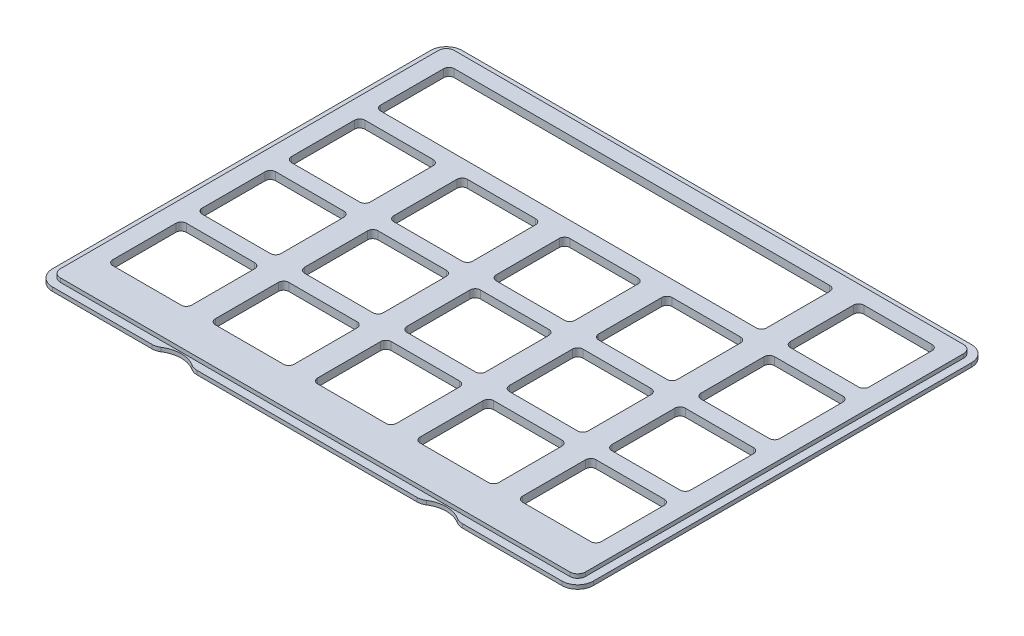
from build123d import *

# Parameters (mm, degrees)
SKETCH1_W                 = 206
SKETCH1_H                 = 156
OUTER_PROFILE_DEPTH       = 1.5
SKETCH2_W                 = 200
SKETCH2_H                 = 150
INNER_PROFILE_DEPTH       = 1.5
FILLET1_R                 = 3
FILLET2_R                 = 6
SKETCH5_W                 = 30
SKETCH5_H                 = 28
CUTOUT_DEPTH              = 130.236217834
CORNER_RAD_R              = 2
LPATTERN1_COUNT           = 5
LPATTERN1_PITCH           = 39
LPATTERN1_COUNT_DIR2      = 4
LPATTERN1_PITCH_DIR2      = 34
CORNER_RAD_OF_LPATTERN1_R = 2
SKETCH6_W                 = 91
SKETCH6_H                 = 28
CUT_EXTRUDE1_DEPTH        = 130.236217834
CUT_EXTRUDE2_DEPTH        = 130.236217834
FILLET3_R                 = 5
FILLET3_OF_MIRROR1_R      = 5


with BuildPart() as part:
    # Sketch1 → Outer Profile (new body)
    with BuildSketch(Plane(origin=(0, 0, 0), x_dir=(1, 0, 0), z_dir=(0, 1, 0))):
        Rectangle(SKETCH1_W, SKETCH1_H)
    extrude(amount=OUTER_PROFILE_DEPTH)

    # Sketch2 → Inner Profile (add)
    with BuildSketch(Plane(origin=(0, 1.5, 0), x_dir=(1, 0, 0), z_dir=(0, 1, 0))):
        Rectangle(SKETCH2_W, SKETCH2_H)
    extrude(amount=INNER_PROFILE_DEPTH)

    # Fillet1
    fillet1_edges = [part.edges().sort_by_distance(p)[0] for p in [
        (100, 2.25, 75),
        (100, 2.25, -75),
        (-100, 2.25, -75),
        (-100, 2.25, 75),
    ]]
    fillet(fillet1_edges, radius=FILLET1_R)

    # Fillet2
    fillet2_edges = [part.edges().sort_by_distance(p)[0] for p in [
        (-103, 0.75, -78),
        (103, 0.75, -78),
        (103, 0.75, 78),
        (-103, 0.75, 78),
    ]]
    fillet(fillet2_edges, radius=FILLET2_R)

    # Sketch5 → Cutout (cut, through all)
    with BuildSketch(Plane(origin=(0, 3, 0), x_dir=(1, 0, 0), z_dir=(0, 1, 0))):
        with Locations((-78, -47)):
            Rectangle(SKETCH5_W, SKETCH5_H)
    cutout = extrude(amount=-CUTOUT_DEPTH, mode=Mode.SUBTRACT)

    # Corner Rad
    corner_rad_edges = [part.edges().sort_by_distance(p)[0] for p in [
        (-63, 1.5, 61),
        (-63, 1.5, 33),
        (-93, 1.5, 33),
        (-93, 1.5, 61),
    ]]
    fillet(corner_rad_edges, radius=CORNER_RAD_R)

    # LPattern1: Cutout 5 × 4
    with Locations(*[(i * LPATTERN1_PITCH, 0, -j * LPATTERN1_PITCH_DIR2) for i in range(LPATTERN1_COUNT) for j in range(LPATTERN1_COUNT_DIR2) if (i, j) != (0, 0)]):
        add(cutout, mode=Mode.SUBTRACT)

    # Corner Rad of LPattern1
    corner_rad_of_lpattern1_edges = [part.edges().sort_by_distance(p)[0] for p in [
        (-63, 1.5, 27),
        (-63, 1.5, -1),
        (-93, 1.5, -1),
        (-93, 1.5, 27),
        (-63, 1.5, -7),
        (-63, 1.5, -35),
        (-93, 1.5, -35),
        (-93, 1.5, -7),
        (-63, 1.5, -41),
        (-63, 1.5, -69),
        (-93, 1.5, -69),
        (-93, 1.5, -41),
        (-24, 1.5, 61),
        (-24, 1.5, 33),
        (-54, 1.5, 33),
        (-54, 1.5, 61),
        (-24, 1.5, 27),
        (-24, 1.5, -1),
        (-54, 1.5, -1),
        (-54, 1.5, 27),
        (-24, 1.5, -7),
        (-24, 1.5, -35),
        (-54, 1.5, -35),
        (-54, 1.5, -7),
        (-24, 1.5, -41),
        (-24, 1.5, -69),
        (-54, 1.5, -69),
        (-54, 1.5, -41),
        (15, 1.5, 61),
        (15, 1.5, 33),
        (-15, 1.5, 33),
        (-15, 1.5, 61),
        (15, 1.5, 27),
        (15, 1.5, -1),
        (-15, 1.5, -1),
        (-15, 1.5, 27),
        (15, 1.5, -7),
        (15, 1.5, -35),
        (-15, 1.5, -35),
        (-15, 1.5, -7),
        (15, 1.5, -41),
        (15, 1.5, -69),
        (-15, 1.5, -69),
        (-15, 1.5, -41),
        (54, 1.5, 61),
        (54, 1.5, 33),
        (24, 1.5, 33),
        (24, 1.5, 61),
        (54, 1.5, 27),
        (54, 1.5, -1),
        (24, 1.5, -1),
        (24, 1.5, 27),
        (54, 1.5, -7),
        (54, 1.5, -35),
        (24, 1.5, -35),
        (24, 1.5, -7),
        (54, 1.5, -41),
        (54, 1.5, -69),
        (24, 1.5, -69),
        (24, 1.5, -41),
        (93, 1.5, 61),
        (93, 1.5, 33),
        (63, 1.5, 33),
        (63, 1.5, 61),
        (93, 1.5, 27),
        (93, 1.5, -1),
        (63, 1.5, -1),
        (63, 1.5, 27),
        (93, 1.5, -7),
        (93, 1.5, -35),
        (63, 1.5, -35),
        (63, 1.5, -7),
        (93, 1.5, -41),
        (93, 1.5, -69),
        (63, 1.5, -69),
        (63, 1.5, -41),
    ]]
    fillet(corner_rad_of_lpattern1_edges, radius=CORNER_RAD_OF_LPATTERN1_R)

    # Sketch6 → Cut-Extrude1 (cut, through all)
    with BuildSketch(Plane(origin=(0, 3, 0), x_dir=(1, 0, 0), z_dir=(0, 1, 0))):
        with Locations((-19.5, 55)):
            Rectangle(SKETCH6_W, SKETCH6_H)
    extrude(amount=-CUT_EXTRUDE1_DEPTH, mode=Mode.SUBTRACT)

    # Sketch7 → Cut-Extrude2 (cut, through all)
    with BuildSketch(Plane(origin=(0, 3, 0), x_dir=(1, 0, 0), z_dir=(0, 1, 0))):
        with BuildLine():
            Line((-57.5, -78), (-43.5, -78))
            ThreePointArc((-43.5, -78), (-50.5, -75.5), (-57.5, -78))
        make_face()
    cut_extrude2 = extrude(amount=-CUT_EXTRUDE2_DEPTH, mode=Mode.SUBTRACT)

    # Fillet3
    fillet3_edges = [part.edges().sort_by_distance(p)[0] for p in [
        (-57.5, 0.75, 78),
        (-43.5, 0.75, 78),
    ]]
    fillet(fillet3_edges, radius=FILLET3_R)

    # Mirror1: Cut-Extrude2 across plane
    add(cut_extrude2.mirror(Plane(origin=(0, 0, 0), x_dir=(0, 0, 1), z_dir=(1, 0, 0))), mode=Mode.SUBTRACT)

    # Fillet3 of Mirror1
    fillet3_of_mirror1_edges = [part.edges().sort_by_distance(p)[0] for p in [
        (57.5, 0.75, 78),
        (43.5, 0.75, 78),
    ]]
    fillet(fillet3_of_mirror1_edges, radius=FILLET3_OF_MIRROR1_R)


solid = part.part
